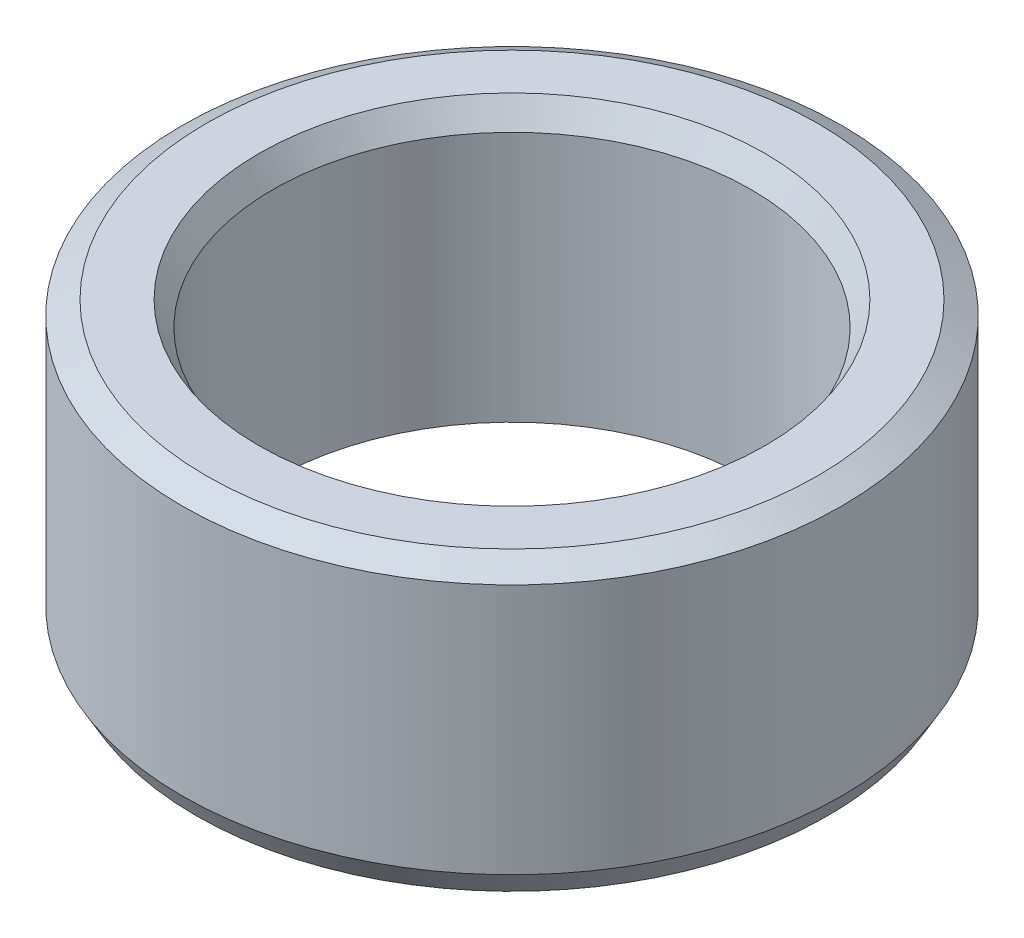
from build123d import *
from OCP.BRepFilletAPI import BRepFilletAPI_MakeChamfer

# Parameters (mm, degrees)
SKETCH1_R           = 12.5
BOSS_EXTRUDE1_DEPTH = 10.965593845
SKETCH2_R           = 9.065940046
CUT_EXTRUDE1_DEPTH  = 21.80250582
CHAMFER1_SIZE       = 0.529956215
CHAMFER1_SIZE2      = 0.917911089


with BuildPart() as part:
    # Sketch1 → Boss-Extrude1 (new body)
    with BuildSketch(Plane(origin=(0, 0, 0), x_dir=(1, 0, 0), z_dir=(0, 1, 0))):
        Circle(SKETCH1_R)
    extrude(amount=BOSS_EXTRUDE1_DEPTH)

    # Sketch2 → Cut-Extrude1 (cut, through all)
    with BuildSketch(Plane(origin=(0, 0, 0), x_dir=(1, 0, 0), z_dir=(0, 1, 0))):
        Circle(SKETCH2_R)
    extrude(amount=CUT_EXTRUDE1_DEPTH, mode=Mode.SUBTRACT)

    # Chamfer1: one chamfer whose edges measure the first distance from different faces: ONE call of the kernel's chamfer builder (chamfer() names one face for all edges)
    chamfer1_edges_1 = [part.edges().sort_by_distance(p)[0] for p in [
        (-9.065940046, 10.965593845, 0),
    ]]
    chamfer1_side_1 = [part.faces().sort_by_distance(p)[0] for p in [
        (-12.146446609, 10.965593845, 0),
    ]]
    chamfer1_edges_2 = [part.edges().sort_by_distance(p)[0] for p in [
        (-9.065940046, 0, 0),
    ]]
    chamfer1_side_2 = [part.faces().sort_by_distance(p)[0] for p in [
        (-9.065940046, 5.482796923, 0),
    ]]
    chamfer1_edges_3 = [part.edges().sort_by_distance(p)[0] for p in [
        (-12.5, 0, 0),
    ]]
    chamfer1_side_3 = [part.faces().sort_by_distance(p)[0] for p in [
        (-12.146446609, 0, 0),
    ]]
    chamfer1_edges_4 = [part.edges().sort_by_distance(p)[0] for p in [
        (-12.5, 10.965593845, 0),
    ]]
    chamfer1_side_4 = [part.faces().sort_by_distance(p)[0] for p in [
        (-12.5, 5.482796923, 0),
    ]]
    chamfer1 = BRepFilletAPI_MakeChamfer(part.part.solid().wrapped)
    for e in chamfer1_edges_1:
        chamfer1.Add(CHAMFER1_SIZE, CHAMFER1_SIZE2, e.wrapped, chamfer1_side_1[0].wrapped)  # the first distance lies on this face
    for e in chamfer1_edges_2:
        chamfer1.Add(CHAMFER1_SIZE, CHAMFER1_SIZE2, e.wrapped, chamfer1_side_2[0].wrapped)  # the first distance lies on this face
    for e in chamfer1_edges_3:
        chamfer1.Add(CHAMFER1_SIZE, CHAMFER1_SIZE2, e.wrapped, chamfer1_side_3[0].wrapped)  # the first distance lies on this face
    for e in chamfer1_edges_4:
        chamfer1.Add(CHAMFER1_SIZE, CHAMFER1_SIZE2, e.wrapped, chamfer1_side_4[0].wrapped)  # the first distance lies on this face
    add(Compound.cast(chamfer1.Shape()), mode=Mode.REPLACE)


solid = part.part
